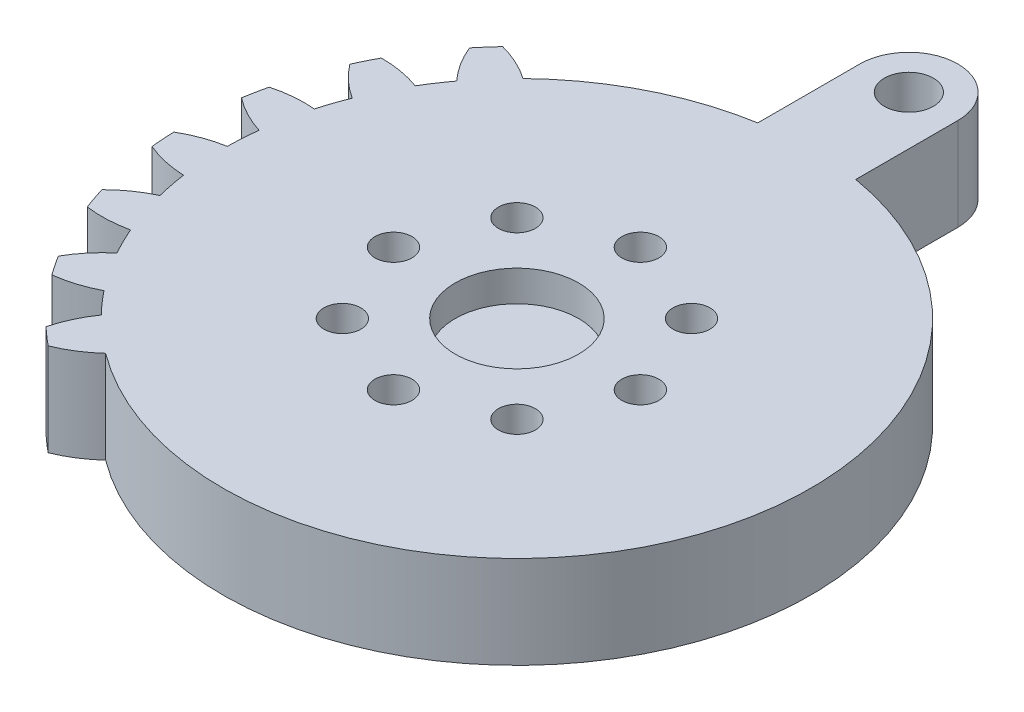
from build123d import *

# Parameters (mm, degrees)
SKETCH1_R                                       = 19.05
BOSS_EXTRUDE1_DEPTH                             = 6
SKETCH8_R                                       = 4
CUT_EXTRUDE4_DEPTH                              = 2
BOSS_EXTRUDE3_DEPTH                             = 6
CIRPATTERN2_DEPTH                               = 6
SKETCH4_R                                       = 1.5875
BOSS_EXTRUDE4_DEPTH                             = 6
CSK_FOR_M2_FLAT_HEAD_MACHINE_SCREW1_D           = 2.4
CSK_FOR_M2_FLAT_HEAD_MACHINE_SCREW1_CSINK_D     = 4.4
CSK_FOR_M2_FLAT_HEAD_MACHINE_SCREW1_CSINK_ANGLE = 90
CIRPATTERN3_COUNT                               = 8


# Read off the part's stored shape, not the designer's step: CirPattern2
with BuildPart() as part:
    # Sketch1 → Boss-Extrude1 (new body)
    with BuildSketch(Plane(origin=(0, 0, 0), x_dir=(1, 0, 0), z_dir=(0, 1, 0))):
        with Locations(Location((0, 0, 0), (0, 0, 270))):
            Circle(SKETCH1_R)
    extrude(amount=BOSS_EXTRUDE1_DEPTH)

    # Sketch8 → Cut-Extrude4 (cut)
    with BuildSketch(Plane.XZ.offset(-6)):
        with Locations(Location((0, 0, 0), (0, 0, 270))):
            Circle(SKETCH8_R)
    extrude(amount=CUT_EXTRUDE4_DEPTH, mode=Mode.SUBTRACT)

    # Sketch3 → Boss-Extrude3 (add)
    with BuildSketch(Plane(origin=(0, 0, 0), x_dir=(1, 0, 0), z_dir=(0, 1, 0))):
        with BuildLine():
            ThreePointArc((-18.32709122, 5.198098444), (-19.680979383, 5.197152008), (-21.013329851, 4.956618665))
            ThreePointArc((-21.013329851, 4.956618665), (-21.175154204, 4.212000052), (-21.310601203, 3.462134657))
            ThreePointArc((-21.310601203, 3.462134657), (-20.171718001, 2.730042376), (-18.921250622, 2.211057413))
            ThreePointArc((-18.921250622, 2.211057413), (-18.683959592, 3.716470634), (-18.32709122, 5.198098444))
        make_face()
    extrude(amount=BOSS_EXTRUDE3_DEPTH)

    # CirPattern2 outline → CirPattern2 (add)
    with BuildSketch(Plane(origin=(0, 0, 0), x_dir=(1, 0, 0), z_dir=(0, 1, 0))):
        with BuildLine():
            ThreePointArc((-17.704260875, 7.032897477), (-17.085425728, 8.425599549), (-16.357243856, 9.764377784))
            ThreePointArc((-16.357243856, 9.764377784), (-17.665244353, 10.113875638), (-19.014450689, 10.226375946))
            ThreePointArc((-19.014450689, 10.226375946), (-19.36348249, 9.549012822), (-19.688393689, 8.859754733))
            ThreePointArc((-19.688393689, 8.859754733), (-18.777796417, 7.857843228), (-17.704260875, 7.032897477))
        make_face()
        with BuildLine():
            ThreePointArc((-15.280755006, 11.375457202), (-14.322548335, 12.560537779), (-13.272677354, 13.665230916))
            ThreePointArc((-13.272677354, 13.665230916), (-14.445652113, 14.341355358), (-15.719768136, 14.799222606))
            ThreePointArc((-15.719768136, 14.799222606), (-16.232221443, 14.235276148), (-16.724454683, 13.653597166))
            ThreePointArc((-16.724454683, 13.653597166), (-16.104199039, 12.450145051), (-15.280755006, 11.375457202))
        make_face()
        with BuildLine():
            ThreePointArc((-11.375457197, -15.280755), (-12.560537774, -14.322548329), (-13.66523091, -13.272677349))
            ThreePointArc((-13.66523091, -13.272677349), (-14.341355358, -14.445652113), (-14.799222606, -15.719768136))
            ThreePointArc((-14.799222606, -15.719768136), (-14.235276148, -16.232221443), (-13.653597166, -16.724454683))
            ThreePointArc((-13.653597166, -16.724454683), (-12.450145051, -16.104199039), (-11.375457197, -15.280755))
        make_face()
        with BuildLine():
            ThreePointArc((-14.942798311, -11.81589093), (-15.839496111, -10.583612937), (-16.634821136, -9.28359982))
            ThreePointArc((-16.634821136, -9.28359982), (-17.59149541, -10.241612555), (-18.363526703, -11.353809363))
            ThreePointArc((-18.363526703, -11.353809363), (-17.95142893, -11.994761331), (-17.516969515, -12.620771728))
            ThreePointArc((-17.516969515, -12.620771728), (-16.193990063, -12.33312711), (-14.942798311, -11.81589093))
        make_face()
        with BuildLine():
            ThreePointArc((-17.491812414, -7.545793421), (-18.039018964, -6.123421813), (-18.470775793, -4.661860306))
            ThreePointArc((-18.470775793, -4.661860306), (-19.642804121, -5.339624026), (-20.676386801, -6.214107244))
            ThreePointArc((-20.676386801, -6.214107244), (-20.444221496, -6.939878056), (-20.18658934, -7.657004037))
            ThreePointArc((-20.18658934, -7.657004037), (-18.834241415, -7.72157295), (-17.491812414, -7.545793421))
        make_face()
        with BuildLine():
            ThreePointArc((-21.580185309, -0.650923987), (-21.543774153, -1.41205356), (-21.480526461, -2.171424174))
            ThreePointArc((-21.480526461, -2.171424174), (-20.190970338, -2.583806354), (-18.84878841, -2.761462559))
            ThreePointArc((-18.84878841, -2.761462559), (-19.009212486, -1.245929612), (-19.047977604, 0.277577285))
            ThreePointArc((-19.047977604, 0.277577285), (-20.355488193, -0.073748943), (-21.580185309, -0.650923987))
        make_face()
    extrude(amount=CIRPATTERN2_DEPTH)

    # Sketch4 → Boss-Extrude4 (add)
    with BuildSketch(Plane(origin=(0, 6, 0), x_dir=(1, 0, 0), z_dir=(0, 1, 0))):
        with BuildLine():
            Line((-3.175, 4.000000056), (3.175, 4.000000056))
            Line((3.175, 4.000000056), (3.175, 25.4))
            ThreePointArc((3.175, 25.4), (0, 28.575), (-3.175, 25.4))
            Line((-3.175, 25.4), (-3.175, 4.000000056))
        make_face()
        with Locations(Location((0, 25.4, 0), (0, 0, 270))):
            Circle(SKETCH4_R, mode=Mode.SUBTRACT)
    extrude(amount=-BOSS_EXTRUDE4_DEPTH)

    # CSK for M2 Flat Head Machine Screw1 (through all)
    with Locations(Plane.XZ):
        with Locations((0, -8)):
            csk_for_m2_flat_head_machine_screw1 = CounterSinkHole(CSK_FOR_M2_FLAT_HEAD_MACHINE_SCREW1_D / 2, CSK_FOR_M2_FLAT_HEAD_MACHINE_SCREW1_CSINK_D / 2, counter_sink_angle=CSK_FOR_M2_FLAT_HEAD_MACHINE_SCREW1_CSINK_ANGLE)

    # CirPattern3: CSK for M2 Flat Head Machine Screw1 ×8 about axis
    cirpattern3_axis = Axis((0, 0, 0), (0, 1, 0))
    for i in range(1, CIRPATTERN3_COUNT):
        add(csk_for_m2_flat_head_machine_screw1.rotate(cirpattern3_axis, i * 360 / CIRPATTERN3_COUNT), mode=Mode.SUBTRACT)


solid = part.part
